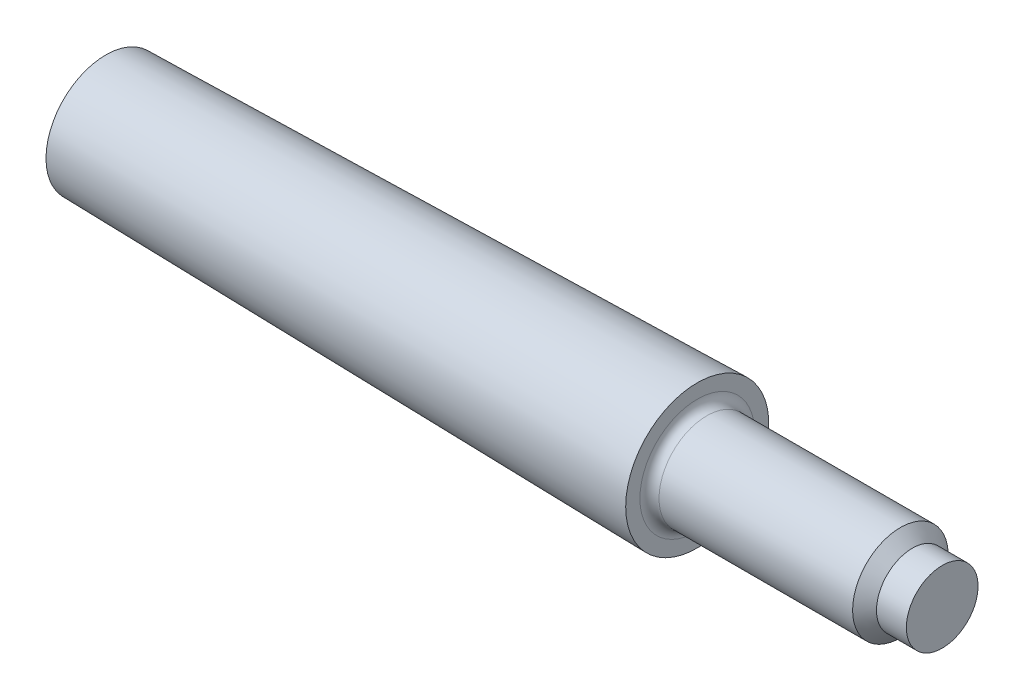
from build123d import *

# Parameters (mm, degrees)
FILLET1_R = 1.6


with BuildPart() as part:
    # BodySke → BaseBody (revolve)
    with BuildSketch(Plane.XY):
        Polygon((-99, 0), (-99, 10), (0, 11.98), (0, 8), (34, 8), (36, 6), (41, 6), (41, 0), align=None)
    revolve(axis=Axis((-250, 0, 0), (1, 0, 0)))

    # Fillet1
    fillet1_edges = [part.edges().sort_by_distance(p)[0] for p in [
        (0, -8, 0),
    ]]
    fillet(fillet1_edges, radius=FILLET1_R)


solid = part.part
